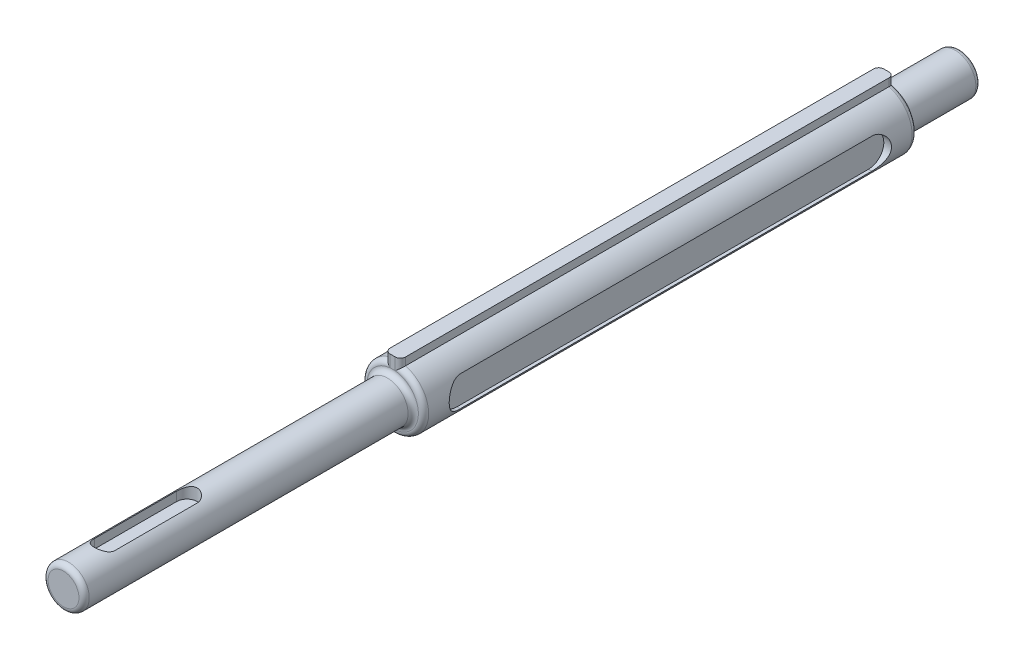
from build123d import *

# Parameters (mm, degrees)
BOSS_EXTRUDE1_DEPTH = 76.2
SKETCH2_R           = 3.175
BOSS_EXTRUDE2_DEPTH = 11.43
BOSS_EXTRUDE3_START = 50.8
SKETCH3_R           = 3.175
BOSS_EXTRUDE3_DEPTH = 50.8
FILLET1_R           = 0.79375
CUT_EXTRUDE1_DEPTH  = 1.190625
CUT_EXTRUDE2_DEPTH  = 4.445


with BuildPart() as part:
    # Sketch1 → Boss-Extrude1 (new body)
    with BuildSketch(Plane.XY):
        with BuildLine():
            Line((1.190625, 4.611270797), (1.190625, 5.801895797))
            Line((1.190625, 5.801895797), (-1.190625, 5.801895797))
            Line((-1.190625, 5.801895797), (-1.190625, 4.611270797))
            ThreePointArc((-1.190625, 4.611270797), (0, -4.7625), (1.190625, 4.611270797))
        make_face()
    extrude(amount=BOSS_EXTRUDE1_DEPTH)

    # Sketch2 → Boss-Extrude2 (add)
    with BuildSketch(Plane(origin=(0, 0, 0), x_dir=(-1, 0, 0), z_dir=(0, 0, -1))):
        Circle(SKETCH2_R)
    extrude(amount=BOSS_EXTRUDE2_DEPTH)

    # Sketch3 → Boss-Extrude3 (add)
    with BuildSketch(Plane.XY.offset(76.2).offset(BOSS_EXTRUDE3_START)):
        with Locations(Location((0, 0, 0), (0, 0, 180))):
            Circle(SKETCH3_R)
    extrude(amount=-BOSS_EXTRUDE3_DEPTH)

    # Fillet1
    fillet1_edges = [part.edges().sort_by_distance(p)[0] for p in [
        (3.175, 0, 0),
        (3.175, 0, -11.43),
        (-1.190625, 5.206583297, 76.2),
        (3.175, 0, 76.2),
        (3.175, 0, 127),
        (0, -4.7625, 76.2),
        (-1.190625, 5.206583297, 0),
        (1.190625, 5.206583297, 0),
        (0, -4.7625, 0),
        (1.190625, 5.206583297, 76.2),
    ]]
    fillet(fillet1_edges, radius=FILLET1_R - 0.0001)  # a hair under: the kernel refuses the full size

    # Sketch4 → Cut-Extrude1 (cut)
    with BuildSketch(Plane(origin=(4.7625, 0, 0), x_dir=(0, 0, -1), z_dir=(1, 0, 0))):
        with BuildLine():
            Line((-69.85, 2.305635398), (-6.35, 2.305635398))
            ThreePointArc((-6.35, 2.305635398), (-3.96875, -0.075614602), (-6.35, -2.456864602))
            Line((-6.35, -2.456864602), (-69.85, -2.456864602))
            ThreePointArc((-69.85, -2.456864602), (-72.23125, -0.075614602), (-69.85, 2.305635398))
        make_face()
    cut_extrude1 = extrude(amount=-CUT_EXTRUDE1_DEPTH, mode=Mode.SUBTRACT)

    # Sketch5 → Cut-Extrude2 (cut)
    with BuildSketch(Plane(origin=(0, 5.801895797, 0), x_dir=(1, 0, 0), z_dir=(0, 1, 0))):
        with BuildLine():
            Line((-1.5875, -120.65), (-1.5875, -107.95))
            ThreePointArc((-1.5875, -107.95), (0, -106.3625), (1.5875, -107.95))
            Line((1.5875, -107.95), (1.5875, -120.65))
            ThreePointArc((1.5875, -120.65), (0, -122.2375), (-1.5875, -120.65))
        make_face()
    extrude(amount=-CUT_EXTRUDE2_DEPTH, mode=Mode.SUBTRACT)

    # Mirror1: Cut-Extrude1 across plane
    add(cut_extrude1.mirror(Plane(origin=(0, 0, 0), x_dir=(0, 0, 1), z_dir=(1, 0, 0))), mode=Mode.SUBTRACT)


solid = part.part
